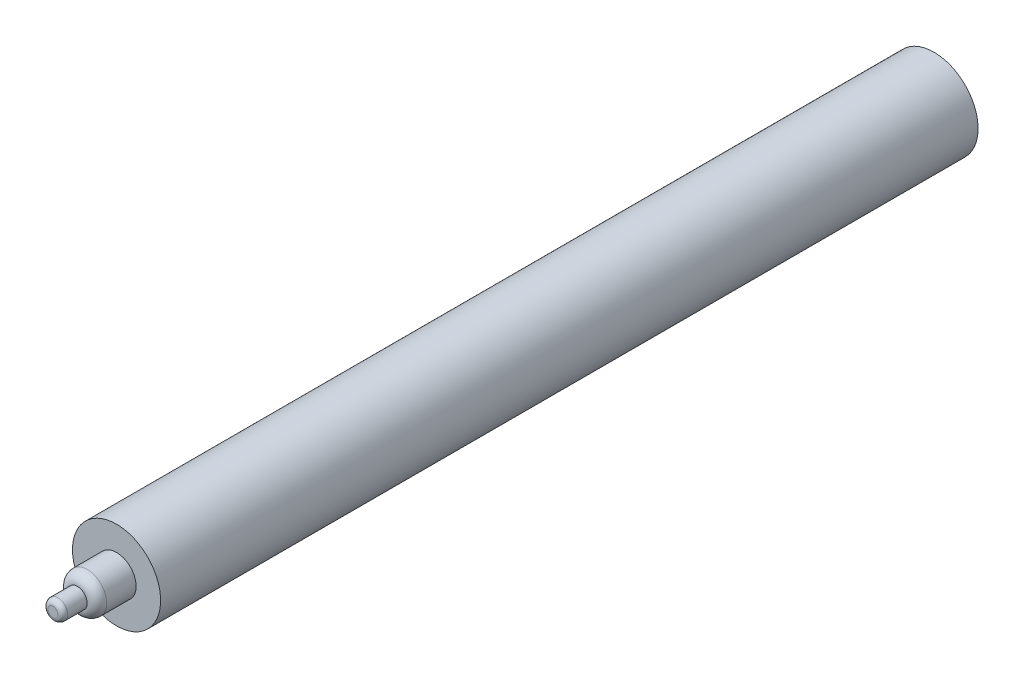
from build123d import *

# Parameters (mm, degrees)
SKETCH_1_R      = 9
EXTRUDE_1_DEPTH = 167
SKETCH_2_R      = 4
EXTRUDE_2_DEPTH = 8
SKETCH_3_R      = 2
EXTRUDE_3_DEPTH = 5
FILLET_1_R      = 2
FILLET_2_R      = 1


with BuildPart() as part:
    # Эскиз1 → Бобышка-Вытянуть1 (new body)
    with BuildSketch(Plane.XY):
        with Locations(Location((0, 0, 0), (0, 0, 180))):
            Circle(SKETCH_1_R)
    extrude(amount=EXTRUDE_1_DEPTH)

    # Эскиз2 → Бобышка-Вытянуть2 (add)
    with BuildSketch(Plane.XY.offset(167)):
        Circle(SKETCH_2_R)
    extrude(amount=EXTRUDE_2_DEPTH)

    # Эскиз3 → Бобышка-Вытянуть3 (add)
    with BuildSketch(Plane.XY.offset(175)):
        Circle(SKETCH_3_R)
    extrude(amount=EXTRUDE_3_DEPTH)

    # Скругление1
    fillet_1_edges = [part.edges().sort_by_distance(p)[0] for p in [
        (-4, 0, 175),
    ]]
    fillet(fillet_1_edges, radius=FILLET_1_R - 0.0001)  # a hair under: the kernel refuses the full size

    # Скругление2
    fillet_2_edges = [part.edges().sort_by_distance(p)[0] for p in [
        (-2, 0, 180),
    ]]
    fillet(fillet_2_edges, radius=FILLET_2_R)


solid = part.part
